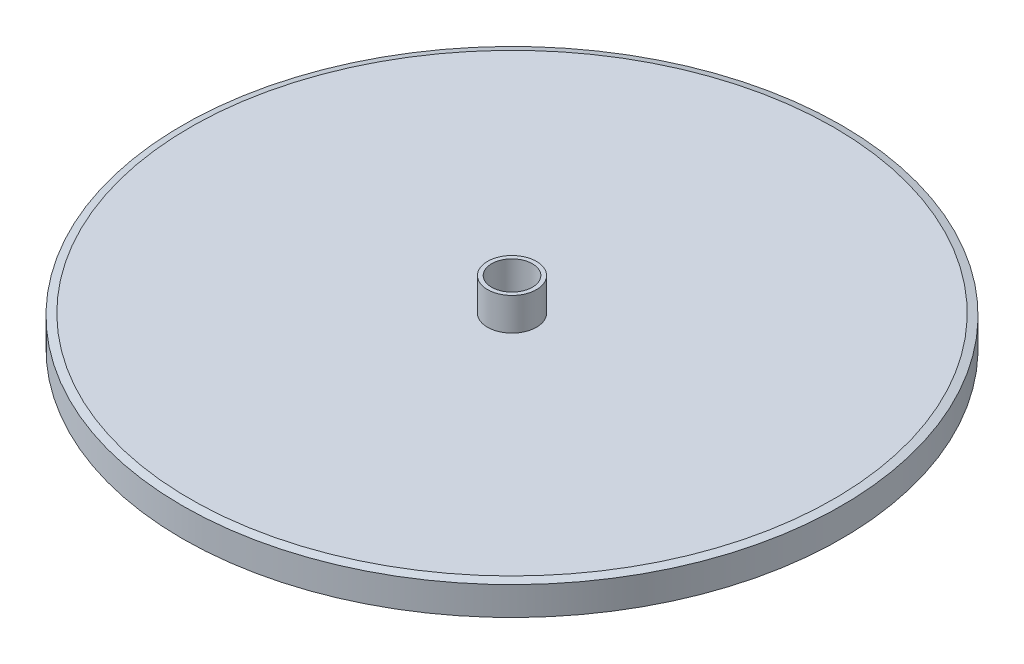
from build123d import *

# Parameters (mm, degrees)
CHAMFER_1_SIZE           = 0.94
CHAMFER_1_SIZE2          = 0.251872241
CHAMFER_2_SIZE           = 0.94
CHAMFER_2_SIZE2          = 0.251872241
CUT_EXTRUDE_3_DEPTH      = 58.691593842
CUT_EXTRUDE_3_DEPTH_BACK = 58.691593842
SKETCH_2_R               = 2.5


with BuildPart() as part:
    # Эскиз1 → Повернуть2 (revolve)
    with BuildSketch(Plane.XY):
        Polygon((0, 0), (40.4, 0), (40.4, 4), (3, 4), (3, 8), (0, 8), align=None)
    revolve(axis=Axis((0, 8, 0), (0, -1, 0)))

    # Фаска1
    chamfer_1_edges = [part.edges().sort_by_distance(p)[0] for p in [
        (-40.4, 4, 0),
    ]]
    chamfer_1_side = [part.faces().sort_by_distance(p)[0] for p in [
        (-39.257315442, 4, 0),
    ]]
    chamfer(chamfer_1_edges, length=CHAMFER_1_SIZE, length2=CHAMFER_1_SIZE2, reference=chamfer_1_side[0])

    # Фаска2
    chamfer_2_edges = [part.edges().sort_by_distance(p)[0] for p in [
        (-40.4, 0, 0),
    ]]
    chamfer_2_side = [part.faces().sort_by_distance(p)[0] for p in [
        (0, 0, 0),
    ]]
    chamfer(chamfer_2_edges, length=CHAMFER_2_SIZE, length2=CHAMFER_2_SIZE2, reference=chamfer_2_side[0])

    # Эскиз2 → Вырез-Вытянуть3 (cut, two sides: drawn at the far end of the back side and taken through both)
    with BuildSketch(Plane(origin=(0, 0, 0), x_dir=(-1, 0, 0), z_dir=(0, -1, 0)).offset(-CUT_EXTRUDE_3_DEPTH_BACK)):
        Circle(SKETCH_2_R)
    extrude(amount=CUT_EXTRUDE_3_DEPTH + CUT_EXTRUDE_3_DEPTH_BACK, mode=Mode.SUBTRACT)


solid = part.part
